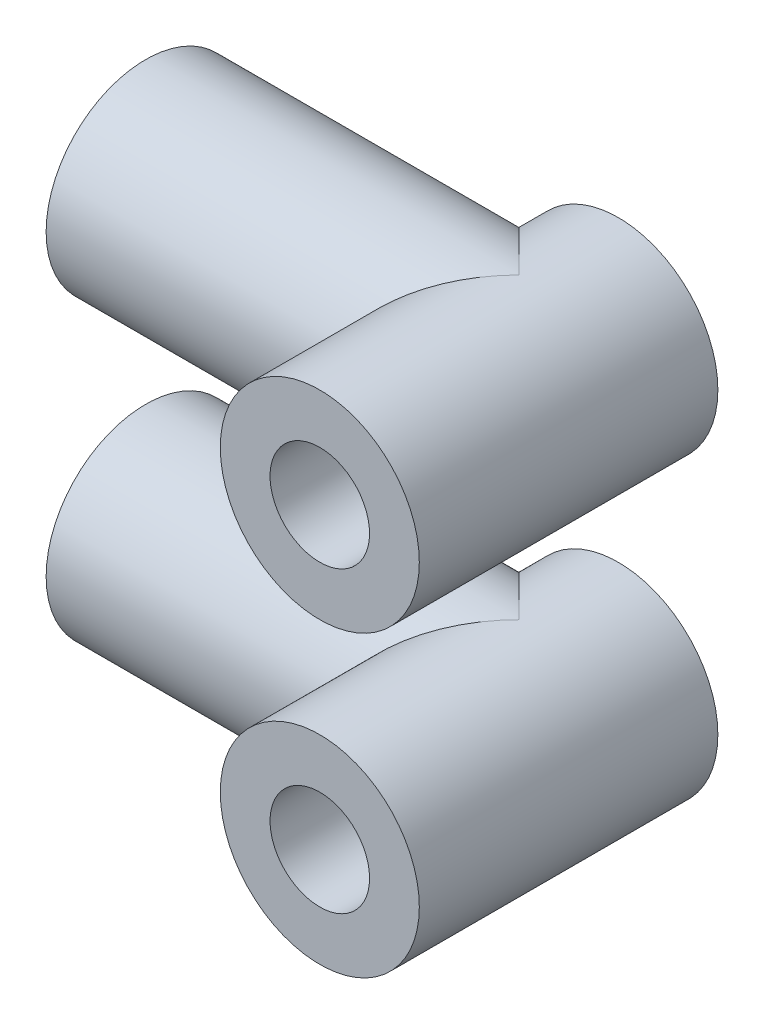
from build123d import *

# Parameters (mm, degrees)
SKETCH1_R           = 4
SKETCH1_R_2         = 2
BOSS_EXTRUDE1_DEPTH = 12
SKETCH2_R           = 4
SKETCH2_R_2         = 2
BOSS_EXTRUDE2_DEPTH = 15
SKETCH3_R           = 2
CUT_EXTRUDE1_DEPTH  = 20.621417008
CUT_EXTRUDE2_REACH  = 24.825
SKETCH4_R           = 2


with BuildPart() as part:
    # Sketch1 → Boss-Extrude1 (new body)
    with BuildSketch(Plane.XY):
        Circle(SKETCH1_R)
        Circle(SKETCH1_R_2, mode=Mode.SUBTRACT)
    extrude(amount=BOSS_EXTRUDE1_DEPTH)

    # Sketch2 → Boss-Extrude2 (add)
    with BuildSketch(Plane(origin=(0, 0, 0), x_dir=(0, 0, -1), z_dir=(1, 0, 0))):
        with Locations((-4, 0)):
            Circle(SKETCH2_R)
        with Locations((-4, 0)):
            Circle(SKETCH2_R_2, mode=Mode.SUBTRACT)
    extrude(amount=-BOSS_EXTRUDE2_DEPTH)

    # Sketch3 → Cut-Extrude1 (cut, through all)
    with BuildSketch(Plane(origin=(0, 0, 0), x_dir=(-1, 0, 0), z_dir=(0, 0, -1))):
        Circle(SKETCH3_R)
    extrude(amount=-CUT_EXTRUDE1_DEPTH, mode=Mode.SUBTRACT)

    # Sketch4 → Cut-Extrude2 (cut, up to next)
    with BuildSketch(Plane.ZY.offset(15), mode=Mode.PRIVATE) as cut_extrude2_sk1:
        with Locations((4, 0)):
            Circle(SKETCH4_R)
    cut_extrude2_tool1 = extrude(cut_extrude2_sk1.sketch, amount=-CUT_EXTRUDE2_REACH, mode=Mode.PRIVATE) & part.part
    add(cut_extrude2_tool1.solids().sort_by_distance((-15, 0, 4))[0], mode=Mode.SUBTRACT)


with BuildPart() as body_2:
    # Mirror1: mirrored copy
    add(part.part.mirror(Plane.ZX.offset(6)))


solid = Compound([part.part, body_2.part])
